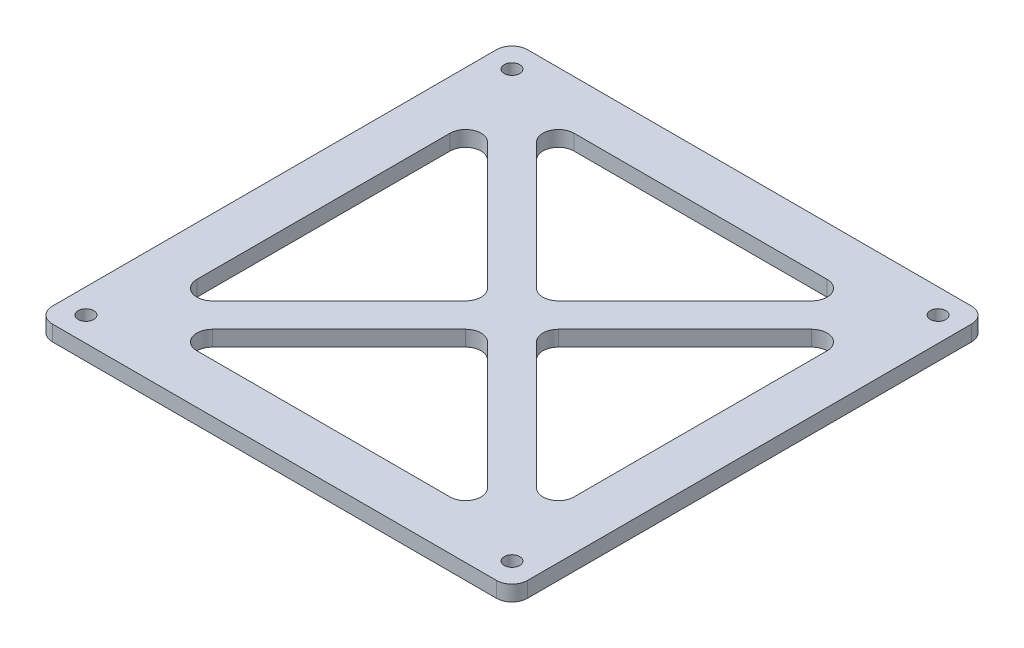
from build123d import *

# Parameters (mm, degrees)
SKETCH_1_W          = 92
SKETCH_1_H          = 92
SKETCH_1_R          = 1.5
EXTRUDE_1_DEPTH     = 3
CUT_EXTRUDE_1_DEPTH = 66.122960621
FILLET_1_R          = 3


with BuildPart() as part:
    # 草圖1 → 填料-伸長1 (new body)
    with BuildSketch(Plane(origin=(0, 0, 0), x_dir=(1, 0, 0), z_dir=(0, 1, 0))):
        Rectangle(SKETCH_1_W, SKETCH_1_H)
        with Locations((-41.25, 41.25)):
            Circle(SKETCH_1_R, mode=Mode.SUBTRACT)
        with Locations((41.25, 41.25)):
            Circle(SKETCH_1_R, mode=Mode.SUBTRACT)
        with Locations((41.25, -41.25)):
            Circle(SKETCH_1_R, mode=Mode.SUBTRACT)
        with Locations((-41.25, -41.25)):
            Circle(SKETCH_1_R, mode=Mode.SUBTRACT)
    extrude(amount=EXTRUDE_1_DEPTH)

    # 草圖3 → 除料-伸長1 (cut, through all)
    with BuildSketch(Plane(origin=(0, 3, 0), x_dir=(1, 0, 0), z_dir=(0, 1, 0))):
        Polygon((-4.75, 0), (-36.5, 31.75), (-36.5, -31.75), align=None)
        Polygon((31.75, 36.5), (-31.75, 36.5), (0, 4.75), align=None)
        Polygon((36.5, -31.75), (36.5, 31.75), (4.75, 0), align=None)
        Polygon((-31.75, -36.5), (31.75, -36.5), (0, -4.75), align=None)
    extrude(amount=-CUT_EXTRUDE_1_DEPTH, mode=Mode.SUBTRACT)

    # 圓角1
    fillet_1_edges = [part.edges().sort_by_distance(p)[0] for p in [
        (36.5, 1.5, 31.75),
        (4.75, 1.5, 0),
        (36.5, 1.5, -31.75),
        (-31.75, 1.5, -36.5),
        (31.75, 1.5, -36.5),
        (0, 1.5, -4.75),
        (-31.75, 1.5, 36.5),
        (31.75, 1.5, 36.5),
        (0, 1.5, 4.75),
        (-36.5, 1.5, 31.75),
        (-4.75, 1.5, 0),
        (-36.5, 1.5, -31.75),
        (-46, 1.5, 46),
        (46, 1.5, 46),
        (46, 1.5, -46),
        (-46, 1.5, -46),
    ]]
    fillet(fillet_1_edges, radius=FILLET_1_R)


solid = part.part
